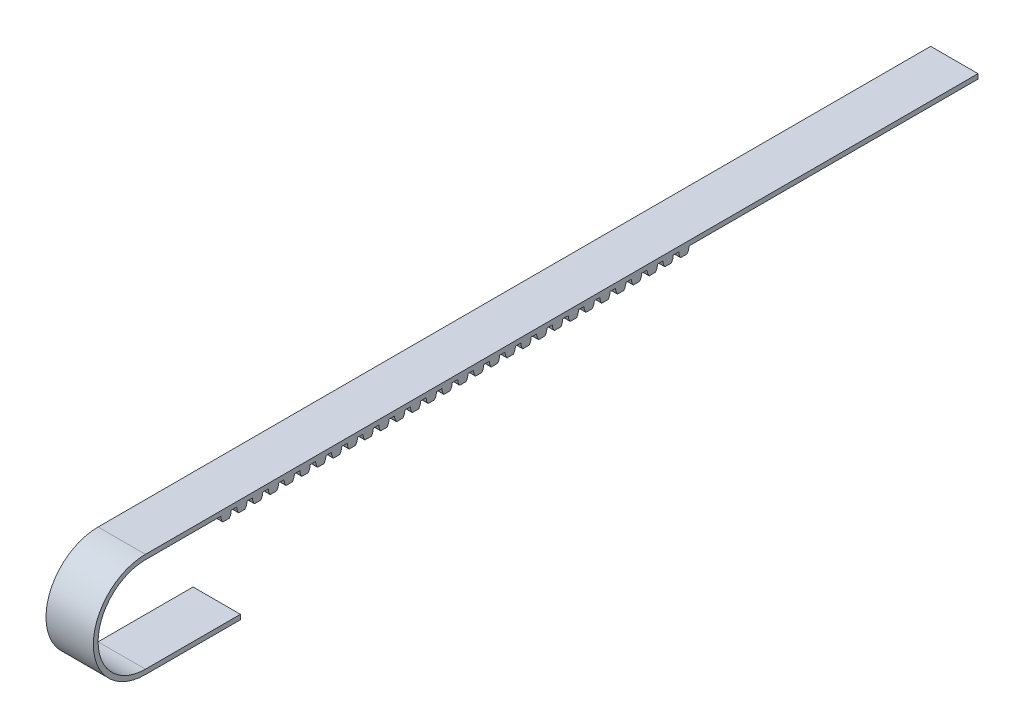
from build123d import *

# Parameters (mm, degrees)
SKETCH_1_W             = 6
SKETCH_1_H             = 0.6
EXTRUDE_1_DEPTH        = 100
EXTRUDE_2_DEPTH        = 6
PATTERN_LINEAR_1_COUNT = 30
PATTERN_LINEAR_1_PITCH = 2
EXTRUDE_3_DEPTH        = 6


with BuildPart() as part:
    # 草图1 → 凸台-拉伸1 (new body)
    with BuildSketch(Plane.XY):
        with Locations((3, 0.3)):
            Rectangle(SKETCH_1_W, SKETCH_1_H)
    extrude(amount=EXTRUDE_1_DEPTH)

    # 草图2 → 凸台-拉伸2 (add)
    with BuildSketch(Plane(origin=(6, 0, 0), x_dir=(0, 0, -1), z_dir=(1, 0, 0))):
        with BuildLine():
            ThreePointArc((-95.914090338, 0), (-95.851247336, -0.399302595), (-95.668794088, -0.76))
            Line((-95.668794088, -0.76), (-94.859386588, -0.76))
            ThreePointArc((-94.859386588, -0.76), (-94.67693334, -0.399302595), (-94.614090338, 0))
            Line((-94.614090338, 0), (-95.914090338, 0))
        make_face()
    extrude_2 = extrude(amount=-EXTRUDE_2_DEPTH)

    # 阵列(线性)1: 凸台-拉伸2 ×30
    with Locations(*[(0, 0, -i * PATTERN_LINEAR_1_PITCH) for i in range(1, PATTERN_LINEAR_1_COUNT)]):
        add(extrude_2)

    # 草图3 → 凸台-拉伸3 (add)
    with BuildSketch(Plane(origin=(6, 0, 0), x_dir=(0, 0, -1), z_dir=(1, 0, 0))):
        with BuildLine():
            Line((-100, 0), (-105.478079639, 0))
            ThreePointArc((-105.478079639, 0), (-111.478079639, -6), (-105.478079639, -12))
            Line((-105.478079639, -12), (-93.443415231, -12))
            Line((-93.443415231, -12), (-93.443415231, -12.6))
            Line((-93.443415231, -12.6), (-105.478079639, -12.6))
            ThreePointArc((-105.478079639, -12.6), (-112.078079639, -6), (-105.478079639, 0.6))
            Line((-105.478079639, 0.6), (-100, 0.6))
            Line((-100, 0.6), (-100, 0))
        make_face()
    extrude(amount=-EXTRUDE_3_DEPTH)


solid = part.part
